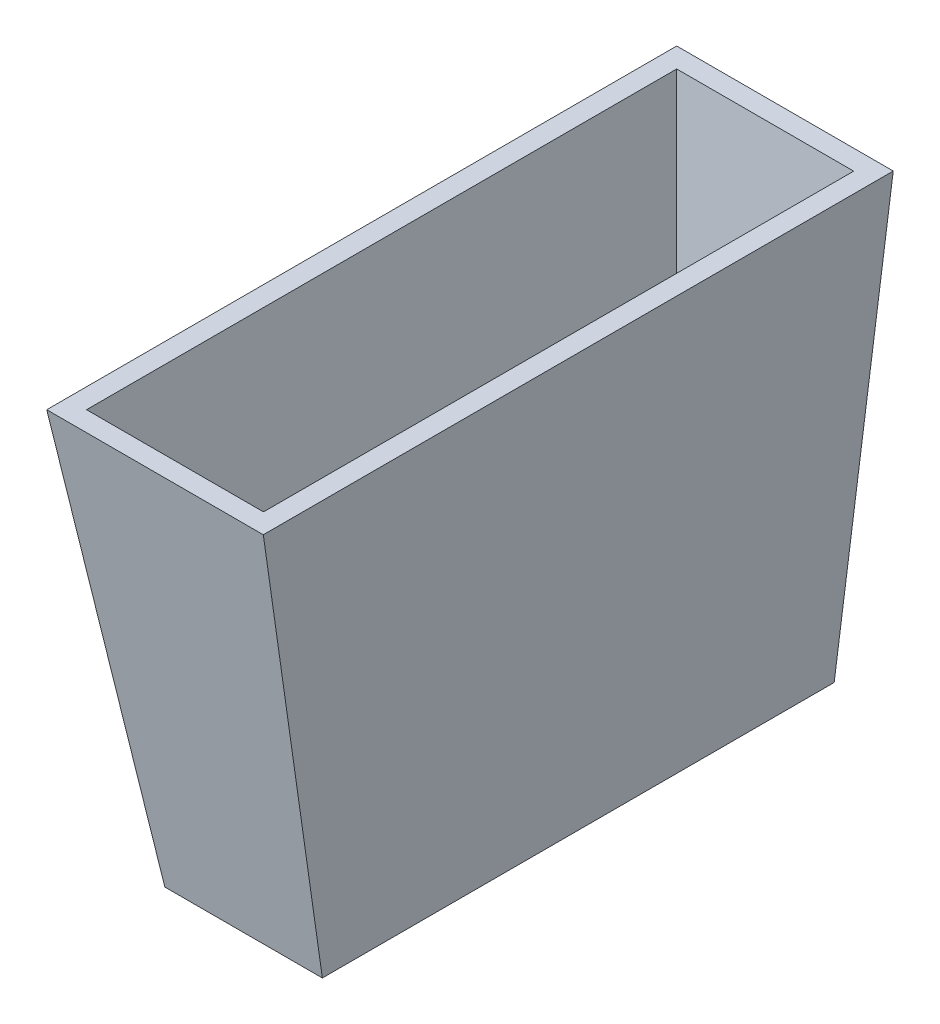
from build123d import *

# Parameters (mm, degrees)
SHELL1_T = -12.7


with BuildPart() as part:
    # Sketch1 → Loft4 section 0
    with BuildSketch(Plane(origin=(0, 0, 0), x_dir=(1, 0, 0), z_dir=(0, 1, 0))):
        with BuildLine():
            Line((0, 0), (-101.6, 0))
            Line((-101.6, 0), (-101.6, 330.2))
            Line((-101.6, 330.2), (0, 330.2))
            Line((0, 330.2), (0, 0))
        make_face()
    # Sketch2 → Loft4 section 1
    with BuildSketch(Plane(origin=(0, 266.7, 0), x_dir=(1, 0, 0), z_dir=(0, 1, 0))):
        with BuildLine():
            Line((-139.7, -38.1), (0, -38.1))
            Line((0, -38.1), (0, 368.3))
            Line((0, 368.3), (-139.7, 368.3))
            Line((-139.7, 368.3), (-139.7, -38.1))
        make_face()
    loft()

    # Shell1
    shell1_openings = [part.faces().sort_by_distance(p)[0] for p in [
        (-69.85, 266.7, -165.1),
    ]]
    offset(amount=SHELL1_T, openings=shell1_openings, kind=Kind.INTERSECTION)


solid = part.part
